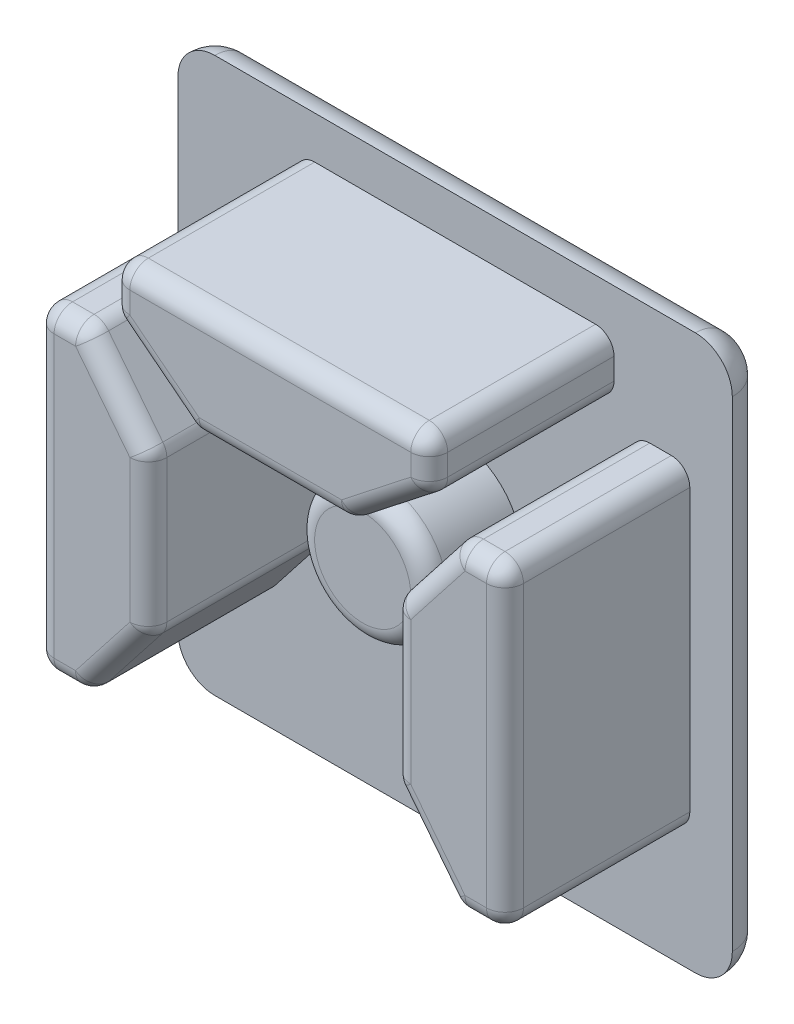
from build123d import *

# Parameters (mm, degrees)
ESQUISSE1_W                        = 30
ESQUISSE1_H                        = 30
BOSS_EXTRU_1_DEPTH                 = 2
BOSS_EXTRU_5_DEPTH                 = 10
CONG_1_R                           = 1
ESQUISSE2_R                        = 3.6
BOSS_EXTRU_6_DEPTH                 = 5
R_P_TITION_CIRCULAIRE1_COUNT       = 3
R_P_TITION_CIRCULAIRE1_ANGLE       = 180
CONG_1_OF_R_P_TITION_CIRCULAIRE1_R = 1
CONG_2_R                           = 2
CONG_3_R                           = 1
CONG_4_R                           = 2


with BuildPart() as part:
    # Esquisse1 → Boss.-Extru.1 (new body)
    with BuildSketch(Plane.XY):
        with Locations((15, 15)):
            Rectangle(ESQUISSE1_W, ESQUISSE1_H)
    extrude(amount=BOSS_EXTRU_1_DEPTH)

    # Esquisse5 → Boss.-Extru.5 (add)
    with BuildSketch(Plane.XY.offset(2)):
        Polygon((27.7, 6.4), (27.7, 23.6), (25.05, 23.6), (21.6, 19.2), (21.6, 10.8), (25.05, 6.4), align=None)
    boss_extru_5 = extrude(amount=BOSS_EXTRU_5_DEPTH)

    # Congé1
    cong_1_edges = [part.edges().sort_by_distance(p)[0] for p in [
        (25.05, 6.4, 7),
        (27.7, 6.4, 7),
        (27.7, 23.6, 7),
        (25.05, 23.6, 7),
        (21.6, 19.2, 7),
        (21.6, 10.8, 7),
    ]]
    fillet(cong_1_edges, radius=CONG_1_R)

    # Esquisse2 → Boss.-Extru.6 (add)
    with BuildSketch(Plane.XY.offset(2)):
        with Locations(Location((15, 15, 0), (0, 0, 180))):
            Circle(ESQUISSE2_R)
    extrude(amount=BOSS_EXTRU_6_DEPTH)

    # Répétition circulaire1: Boss.-Extru.5 ×3 about axis
    r_p_tition_circulaire1_axis = Axis((15, 15, 0), (0, 0, 1))
    for i in range(1, R_P_TITION_CIRCULAIRE1_COUNT):
        add(boss_extru_5.rotate(r_p_tition_circulaire1_axis, i * R_P_TITION_CIRCULAIRE1_ANGLE / (R_P_TITION_CIRCULAIRE1_COUNT - 1)))

    # Congé1 of Répétition circulaire1
    cong_1_of_r_p_tition_circulaire1_edges = [part.edges().sort_by_distance(p)[0] for p in [
        (23.6, 25.05, 7),
        (23.6, 27.7, 7),
        (6.4, 27.7, 7),
        (6.4, 25.05, 7),
        (10.8, 21.6, 7),
        (19.2, 21.6, 7),
        (4.95, 23.6, 7),
        (2.3, 23.6, 7),
        (2.3, 6.4, 7),
        (4.95, 6.4, 7),
        (8.4, 10.8, 7),
        (8.4, 19.2, 7),
    ]]
    fillet(cong_1_of_r_p_tition_circulaire1_edges, radius=CONG_1_OF_R_P_TITION_CIRCULAIRE1_R)

    # Congé2
    cong_2_edges = [part.edges().sort_by_distance(p)[0] for p in [
        (0, 30, 1),
        (30, 30, 1),
        (30, 0, 1),
        (0, 0, 1),
    ]]
    fillet(cong_2_edges, radius=CONG_2_R)

    # Congé3
    cong_3_edges = [part.edges().sort_by_distance(p)[0] for p in [
        (15, 27.7, 12),
        (23.6, 26.118328167, 12),
        (6.4, 26.118328167, 12),
        (8.655619048, 23.28138961, 12),
        (15, 21.6, 12),
        (21.344380952, 23.28138961, 12),
        (6.500824998, 25.099067124, 12),
        (10.818910387, 21.654764961, 12),
        (19.181089613, 21.654764961, 12),
        (23.499175002, 25.099067124, 12),
        (6.692893219, 27.407106781, 12),
        (23.307106781, 27.407106781, 12),
        (2.3, 15, 12),
        (3.881671833, 23.6, 12),
        (3.881671833, 6.4, 12),
        (6.71861039, 8.655619048, 12),
        (8.4, 15, 12),
        (6.71861039, 21.344380952, 12),
        (4.900932876, 6.500824998, 12),
        (8.345235039, 10.818910387, 12),
        (8.345235039, 19.181089613, 12),
        (4.900932876, 23.499175002, 12),
        (2.592893219, 6.692893219, 12),
        (2.592893219, 23.307106781, 12),
        (27.7, 15, 12),
        (26.118328167, 6.4, 12),
        (26.118328167, 23.6, 12),
        (23.28138961, 21.344380952, 12),
        (21.6, 15, 12),
        (23.28138961, 8.655619048, 12),
        (25.099067124, 23.499175002, 12),
        (21.654764961, 19.181089613, 12),
        (21.654764961, 10.818910387, 12),
        (25.099067124, 6.500824998, 12),
        (27.407106781, 23.307106781, 12),
        (27.407106781, 6.692893219, 12),
        (18.6, 15, 7),
    ]]
    fillet(cong_3_edges, radius=CONG_3_R)

    # Congé4
    cong_4_edges = [part.edges().sort_by_distance(p)[0] for p in [
        (29.414213562, 29.414213562, 0),
        (15, 30, 0),
        (0.585786438, 29.414213562, 0),
        (0, 15, 0),
        (0.585786438, 0.585786438, 0),
        (15, 0, 0),
        (29.414213562, 0.585786438, 0),
        (30, 15, 0),
    ]]
    fillet(cong_4_edges, radius=CONG_4_R - 0.0001)  # a hair under: the kernel refuses the full size


solid = part.part
